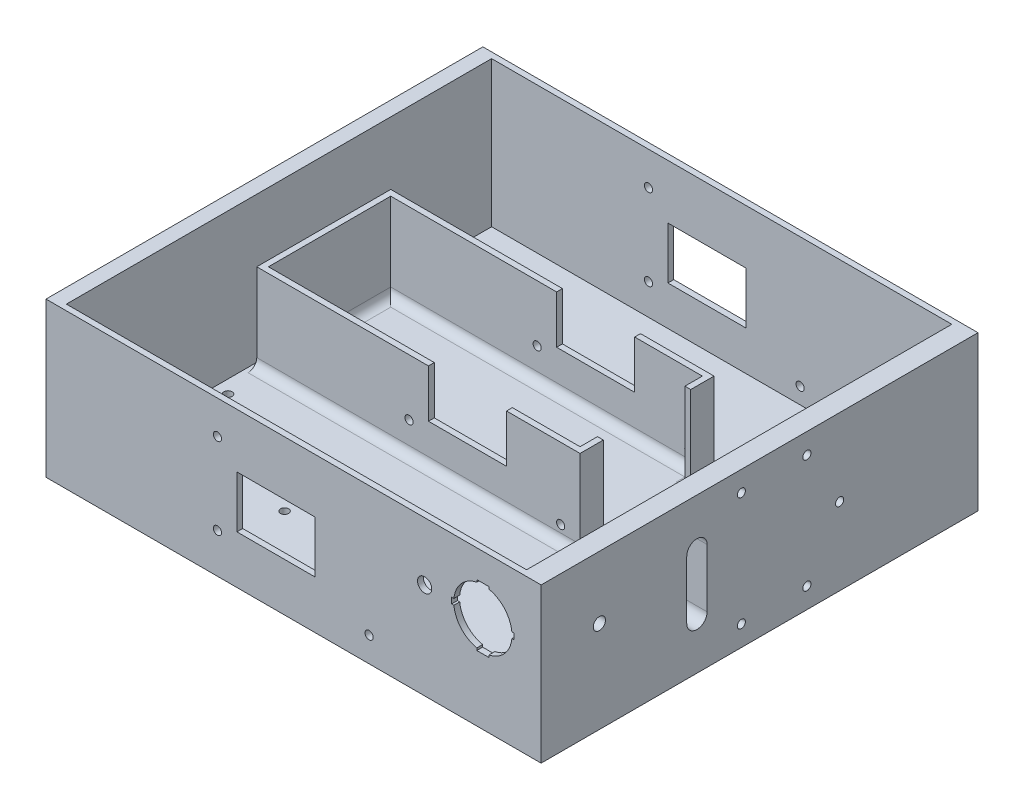
from build123d import *

# Parameters (mm, degrees)
SKETCH1_W                = 170
SKETCH1_H                = 150
BOSS_EXTRUDE1_DEPTH      = 3
SKETCH2_W                = 170
SKETCH2_H                = 150
SKETCH2_W_2              = 158
SKETCH2_H_2              = 146
BOSS_EXTRUDE2_DEPTH      = 50
SKETCH3_R                = 1
CUT_EXTRUDE1_DEPTH       = 194.220081772
SKETCH4_R                = 2.1
SKETCH4_R_2              = 1.4
CUT_EXTRUDE2_DEPTH       = 188.090887004
SKETCH5_W                = 5.5
SKETCH5_H                = 5.5
NUT_CAVITIES_DEPTH       = 2.5
MOTOR_CABLE_CUTOUT_DEPTH = 10
SKETCH10_R               = 2.45
SWITCH_AND_LED_DEPTH     = 10
SKETCH11_R               = 1.4
BOTTOMFACESTANDOFF_DEPTH = 10
BOSS_EXTRUDE4_DEPTH      = 30
FILLET3_R                = 3
SKETCH13_R               = 1.4
SKETCH13_W               = 26.797058611
SKETCH13_H               = 17.831371518
ARDUINO_DEPTH            = 181.371838157


with BuildPart() as part:
    # Sketch1 → Boss-Extrude1 (new body)
    with BuildSketch(Plane(origin=(0, 0, 0), x_dir=(1, 0, 0), z_dir=(0, 1, 0))):
        Rectangle(SKETCH1_W, SKETCH1_H)
    extrude(amount=BOSS_EXTRUDE1_DEPTH)

    # Sketch2 → Boss-Extrude2 (add)
    with BuildSketch(Plane(origin=(0, 3, 0), x_dir=(1, 0, 0), z_dir=(0, 1, 0))):
        Rectangle(SKETCH2_W, SKETCH2_H)
        with Locations((-1, 0)):
            Rectangle(SKETCH2_W_2, SKETCH2_H_2, mode=Mode.SUBTRACT)
    extrude(amount=BOSS_EXTRUDE2_DEPTH)

    # Sketch3 → Cut-Extrude1 (cut, through all)
    with BuildSketch(Plane(origin=(85, 0, 0), x_dir=(0, 0, -1), z_dir=(1, 0, 0))):
        with Locations((-55, 31.5)):
            Circle(SKETCH3_R)
    extrude(amount=-CUT_EXTRUDE1_DEPTH, mode=Mode.SUBTRACT)

    # Sketch4 → Cut-Extrude2 (cut, through all)
    with BuildSketch(Plane.ZY.offset(-78)):
        with Locations((55, 31.5)):
            Circle(SKETCH4_R)
        with Locations((6.25, 45.985571585)):
            Circle(SKETCH4_R_2)
        with Locations((-16.25, 45.985571585)):
            Circle(SKETCH4_R_2)
        with Locations((-27.5, 26.5)):
            Circle(SKETCH4_R_2)
        with Locations((-16.25, 7.014428415)):
            Circle(SKETCH4_R_2)
        with Locations((6.25, 7.014428415)):
            Circle(SKETCH4_R_2)
    extrude(amount=-CUT_EXTRUDE2_DEPTH, mode=Mode.SUBTRACT)

    # Sketch5 → Nut cavities (cut)
    with BuildSketch(Plane.ZY.offset(-78)):
        with Locations((36.693473846, 34.404074386)):
            Rectangle(SKETCH5_W, SKETCH5_H)
        with Locations((50.549880307, 42.404074386)):
            Rectangle(SKETCH5_W, SKETCH5_H)
        with Locations((44.920715182, 29.654074386)):
            Rectangle(SKETCH5_W, SKETCH5_H)
        with Locations((36.693473846, 18.404074386)):
            Rectangle(SKETCH5_W, SKETCH5_H)
        with Locations((50.549880307, 10.404074386)):
            Rectangle(SKETCH5_W, SKETCH5_H)
        with Locations((50.549880307, 19.904074386)):
            Rectangle(SKETCH5_W, SKETCH5_H)
        with Locations((64.406286767, 18.404074386)):
            Rectangle(SKETCH5_W, SKETCH5_H)
        with Locations((56.179045431, 29.654074386)):
            Rectangle(SKETCH5_W, SKETCH5_H)
        with Locations((64.406286767, 34.404074386)):
            Rectangle(SKETCH5_W, SKETCH5_H)
    extrude(amount=-NUT_CAVITIES_DEPTH, mode=Mode.SUBTRACT)

    # Sketch8 → Motor cable cutout (cut)
    with BuildSketch(Plane(origin=(85, 0, 0), x_dir=(0, 0, -1), z_dir=(1, 0, 0))):
        with BuildLine():
            Line((-18, 36.5), (-18, 16.5))
            ThreePointArc((-18, 16.5), (-21.5, 13), (-25, 16.5))
            Line((-25, 16.5), (-25, 36.5))
            ThreePointArc((-25, 36.5), (-21.5, 40), (-18, 36.5))
        make_face()
    extrude(amount=-MOTOR_CABLE_CUTOUT_DEPTH, mode=Mode.SUBTRACT)

    # Sketch10 → Switch and LED (cut)
    with BuildSketch(Plane.XY.offset(75)):
        with Locations((45, 33)):
            Circle(SKETCH10_R)
        with BuildLine():
            Line((55.050125629, 34), (54.296612686, 34))
            Line((54.296612686, 34), (54.296612686, 32))
            Line((54.296612686, 32), (55.050125629, 32))
            ThreePointArc((55.050125629, 32), (57.546218332, 26.333581258), (62.9, 23.222986141))
            Line((62.9, 23.222986141), (62.9, 22.457111402))
            Line((62.9, 22.457111402), (67.1, 22.457111402))
            Line((67.1, 22.457111402), (67.1, 23.222986141))
            ThreePointArc((67.1, 23.222986141), (72.453781668, 26.333581258), (74.949874371, 32))
            Line((74.949874371, 32), (75.703387314, 32))
            Line((75.703387314, 32), (75.703387314, 34))
            Line((75.703387314, 34), (74.949874371, 34))
            ThreePointArc((74.949874371, 34), (72.453781668, 39.666418742), (67.1, 42.777013859))
            Line((67.1, 42.777013859), (67.1, 43.542888598))
            Line((67.1, 43.542888598), (62.9, 43.542888598))
            Line((62.9, 43.542888598), (62.9, 42.777013859))
            ThreePointArc((62.9, 42.777013859), (57.546218332, 39.666418742), (55.050125629, 34))
        make_face()
    extrude(amount=-SWITCH_AND_LED_DEPTH, mode=Mode.SUBTRACT)

    # Sketch11 → BottomFaceStandoff (cut)
    with BuildSketch(Plane(origin=(0, 3, 0), x_dir=(1, 0, 0), z_dir=(0, 1, 0))):
        with Locations((-75.50000086, -21.99999962)):
            Circle(SKETCH11_R)
        with Locations((-70.9999997, -47.10000022)):
            Circle(SKETCH11_R)
        with Locations((-75.50000086, -65.49999898)):
            Circle(SKETCH11_R)
        with Locations((-31.00000096, -47.10000022)):
            Circle(SKETCH11_R)
        with Locations((7.50000078, -47.10000022)):
            Circle(SKETCH11_R)
        with Locations((49.9999996, -47.10000022)):
            Circle(SKETCH11_R)
        with Locations((59.99999992, -21.99999962)):
            Circle(SKETCH11_R)
        with Locations((59.99999992, -65.49999898)):
            Circle(SKETCH11_R)
        with Locations((51.408299451, 42.693411504)):
            Circle(SKETCH11_R)
        with Locations((72.461041146, 2.808175299)):
            Circle(SKETCH11_R)
        with Locations((-67.25562484, 56.064339515)):
            Circle(SKETCH11_R)
        with Locations((-47.05562484, 56.064339515)):
            Circle(SKETCH11_R)
    extrude(amount=-BOTTOMFACESTANDOFF_DEPTH, mode=Mode.SUBTRACT)

    # Sketch12 → Boss-Extrude4 (add)
    with BuildSketch(Plane(origin=(0, 3, 0), x_dir=(1, 0, 0), z_dir=(0, 1, 0))):
        Polygon((32.583892209, -1.219254478), (32.583892209, -9.219254478), (-78.416107791, -9.219254478), (-78.416107791, 36.780745522), (32.583892209, 36.780745522), (32.583892209, 28.780745522), (30.583892209, 28.780745522), (30.583892209, 34.780745522), (-76.416107791, 34.780745522), (-76.416107791, -7.219254478), (30.583892209, -7.219254478), (30.583892209, -1.219254478), align=None)
    extrude(amount=BOSS_EXTRUDE4_DEPTH)

    # Fillet3
    fillet3_edges = [part.edges().sort_by_distance(p)[0] for p in [
        (30.583892209, 3, 4.219254478),
        (30.583892209, 3, -31.780745522),
        (-76.416107791, 3, -13.780745522),
        (-22.916107791, 3, 7.219254478),
        (-22.916107791, 3, -34.780745522),
        (-22.916107791, 3, -36.780745522),
        (32.583892209, 3, -32.780745522),
        (32.583892209, 3, 5.219254478),
        (-22.916107791, 3, 9.219254478),
    ]]
    fillet(fillet3_edges, radius=FILLET3_R)

    # Sketch13 → Arduino (cut, through all)
    with BuildSketch(Plane(origin=(0, 0, -75), x_dir=(-1, 0, 0), z_dir=(0, 0, -1))):
        with Locations((26.142977493, 41.56)):
            Circle(SKETCH13_R)
        with Locations((-25.927022507, 8.54)):
            Circle(SKETCH13_R)
        with Locations((26.142977493, 13.62)):
            Circle(SKETCH13_R)
        with Locations((6.065355432, 25.463348795)):
            Rectangle(SKETCH13_W, SKETCH13_H)
    extrude(amount=-ARDUINO_DEPTH, mode=Mode.SUBTRACT)


solid = part.part
